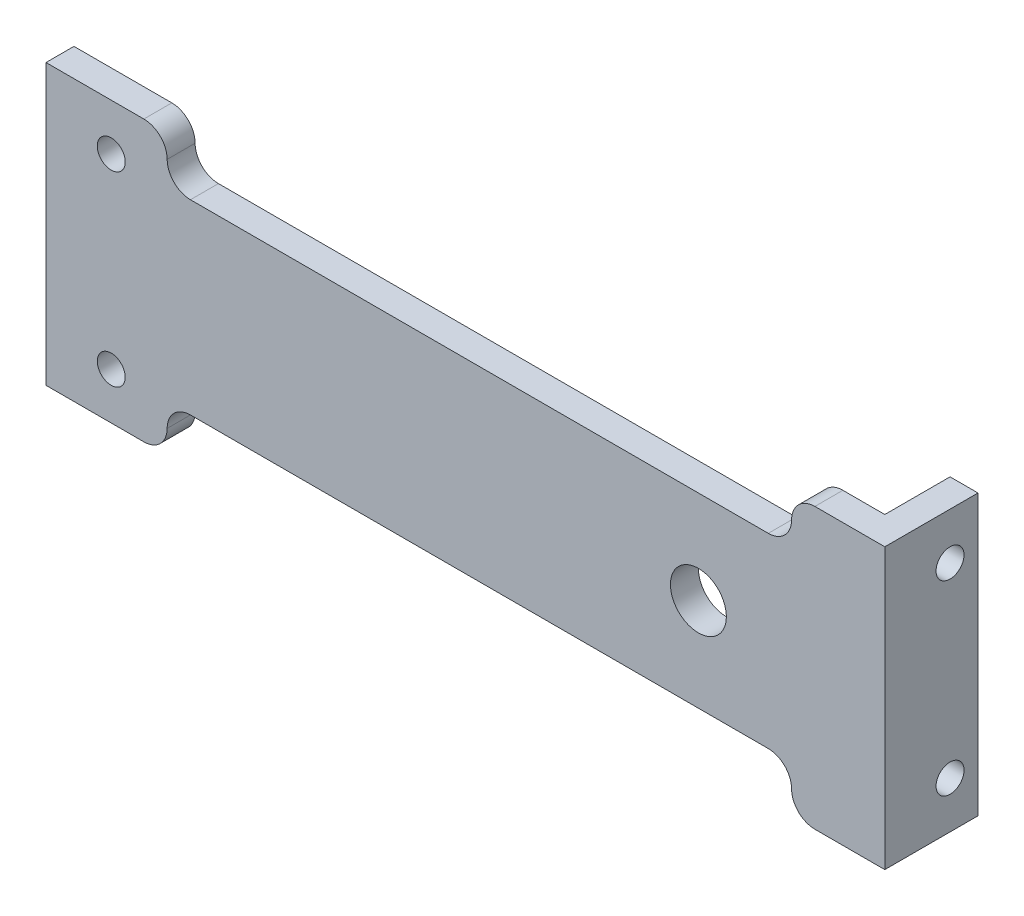
from build123d import *

# Parameters (mm, degrees)
SKETCH1_W           = 90
SKETCH1_H           = 30
BOSS_EXTRUDE1_DEPTH = 3
SKETCH2_R           = 1.5
CUT_EXTRUDE1_DEPTH  = 3
SKETCH3_W           = 3
SKETCH3_H           = 30
BOSS_EXTRUDE2_DEPTH = 7
SKETCH4_R           = 1.5
CUT_EXTRUDE2_DEPTH  = 7
SKETCH5_W           = 67
SKETCH5_H           = 5
CUT_EXTRUDE3_DEPTH  = 7
FILLET1_START       = -7
FILLET1_DEPTH       = 11
FILLET1_2_DEPTH     = 3
SKETCH6_R           = 3
CUT_EXTRUDE4_DEPTH  = 10


with BuildPart() as part:
    # Sketch1 → Boss-Extrude1 (new body)
    with BuildSketch(Plane.XY):
        Rectangle(SKETCH1_W, SKETCH1_H)
    extrude(amount=BOSS_EXTRUDE1_DEPTH)

    # Sketch2 → Cut-Extrude1 (cut)
    with BuildSketch(Plane.XY.offset(3)):
        with Locations((-38, 10)):
            Circle(SKETCH2_R)
    cut_extrude1 = extrude(amount=-CUT_EXTRUDE1_DEPTH, mode=Mode.SUBTRACT)

    # Sketch3 → Boss-Extrude2 (add)
    with BuildSketch(Plane(origin=(0, 0, 0), x_dir=(-1, 0, 0), z_dir=(0, 0, -1))):
        with Locations((-43.5, 0)):
            Rectangle(SKETCH3_W, SKETCH3_H)
    extrude(amount=BOSS_EXTRUDE2_DEPTH)

    # Sketch4 → Cut-Extrude2 (cut)
    with BuildSketch(Plane.ZY.offset(-42)):
        with Locations((-4, 10)):
            Circle(SKETCH4_R)
    cut_extrude2 = extrude(amount=-CUT_EXTRUDE2_DEPTH, mode=Mode.SUBTRACT)

    # Sketch5 → Cut-Extrude3 (cut)
    with BuildSketch(Plane.XY.offset(3)):
        with Locations((1.5, 12.5)):
            Rectangle(SKETCH5_W, SKETCH5_H)
    cut_extrude3 = extrude(amount=-CUT_EXTRUDE3_DEPTH, mode=Mode.SUBTRACT)

    # Mirror1: Cut-Extrude1, Cut-Extrude2, Cut-Extrude3 across plane
    add(cut_extrude1.mirror(Plane.ZX), mode=Mode.SUBTRACT)
    add(cut_extrude2.mirror(Plane.ZX), mode=Mode.SUBTRACT)
    add(cut_extrude3.mirror(Plane.ZX), mode=Mode.SUBTRACT)

    # Fillet1: read off the stored shape, not the designer's step
    # Fillet1 outline → Fillet1 (cut)
    with BuildSketch(Plane.XY.offset(FILLET1_START)):
        with BuildLine():
            Line((-32, -15), (-32, -12.5))
            ThreePointArc((-32, -12.5), (-32.732233047, -14.267766953), (-34.5, -15))
            Line((-34.5, -15), (-32, -15))
        make_face()
        with BuildLine():
            ThreePointArc((37.5, -15), (35.732233047, -14.267766953), (35, -12.5))
            Line((35, -12.5), (35, -15))
            Line((35, -15), (37.5, -15))
        make_face()
        with BuildLine():
            ThreePointArc((-34.5, 15), (-32.732233047, 14.267766953), (-32, 12.5))
            Line((-32, 12.5), (-32, 15))
            Line((-32, 15), (-34.5, 15))
        make_face()
        with BuildLine():
            ThreePointArc((35, 12.5), (35.732233047, 14.267766953), (37.5, 15))
            Line((37.5, 15), (35, 15))
            Line((35, 15), (35, 12.5))
        make_face()
    extrude(amount=FILLET1_DEPTH, mode=Mode.SUBTRACT)

    # Fillet1 2 outline → Fillet1 2 (add)
    with BuildSketch(Plane.XY):
        with BuildLine():
            Line((35, -10), (32.5, -10))
            ThreePointArc((32.5, -10), (34.267766953, -10.732233047), (35, -12.5))
            Line((35, -12.5), (35, -10))
        make_face()
        with BuildLine():
            ThreePointArc((-32, -12.5), (-31.267766953, -10.732233047), (-29.5, -10))
            Line((-29.5, -10), (-32, -10))
            Line((-32, -10), (-32, -12.5))
        make_face()
        with BuildLine():
            Line((-32, 10), (-29.5, 10))
            ThreePointArc((-29.5, 10), (-31.267766953, 10.732233047), (-32, 12.5))
            Line((-32, 12.5), (-32, 10))
        make_face()
        with BuildLine():
            Line((35, 10), (35, 12.5))
            ThreePointArc((35, 12.5), (34.267766953, 10.732233047), (32.5, 10))
            Line((32.5, 10), (35, 10))
        make_face()
    extrude(amount=FILLET1_2_DEPTH)

    # Sketch6 → Cut-Extrude4 (cut)
    with BuildSketch(Plane.XY.offset(3)):
        with Locations((25, 0)):
            Circle(SKETCH6_R)
    extrude(amount=-CUT_EXTRUDE4_DEPTH, mode=Mode.SUBTRACT)


solid = part.part
